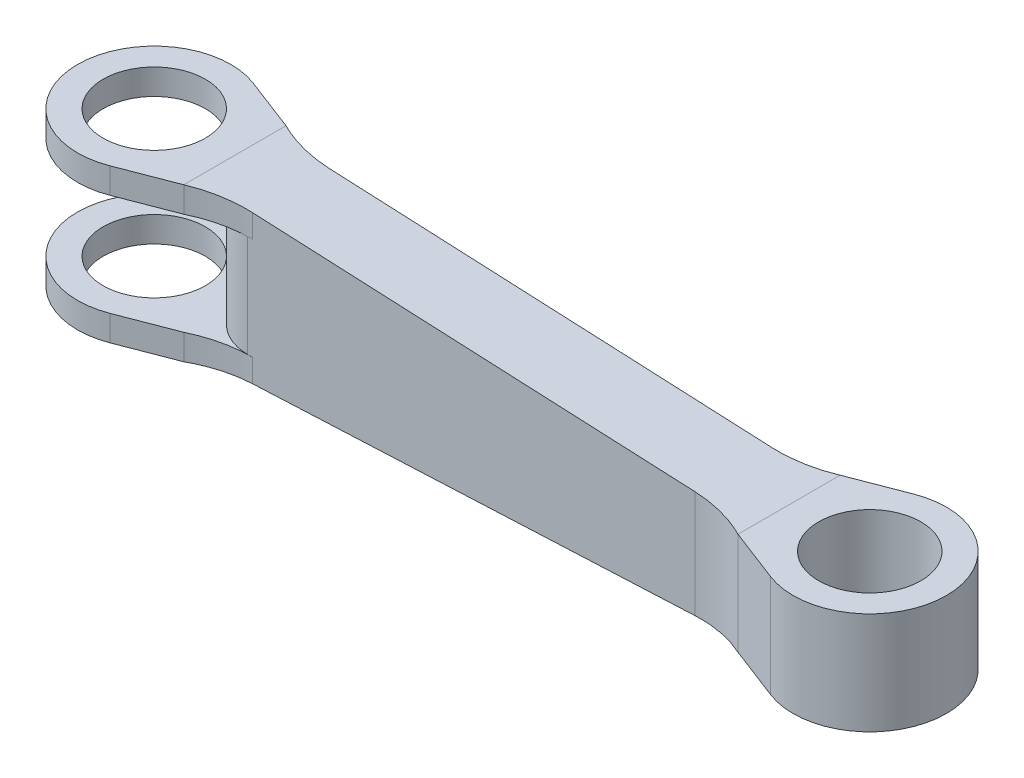
from build123d import *

# Parameters (mm, degrees)
SKETCH1_R           = 5.08
BOSS_EXTRUDE1_DEPTH = 7.62
SKETCH2_W           = 15.638324702
SKETCH2_H           = 10.16
CUT_EXTRUDE1_DEPTH  = 83.001098163
FILLET1_R           = 12.7
FILLET2_R           = 5.08


with BuildPart() as part:
    # Sketch1 → Boss-Extrude1 (new, symmetric)
    with BuildSketch(Plane(origin=(0, 0, 0), x_dir=(1, 0, 0), z_dir=(0, 1, 0))):
        with BuildLine():
            Line((2.735663722, 7.112), (8.018324702, 5.08))
            Line((8.018324702, 5.08), (8.018324702, 3.81))
            Line((8.018324702, 3.81), (63.101675298, 3.81))
            Line((63.101675298, 3.81), (63.101675298, 5.08))
            Line((63.101675298, 5.08), (68.384336278, 7.112))
            ThreePointArc((68.384336278, 7.112), (78.74, 0), (68.384336278, -7.112))
            Line((68.384336278, -7.112), (63.101675298, -5.08))
            Line((63.101675298, -5.08), (63.101675298, -3.81))
            Line((63.101675298, -3.81), (8.018324702, -3.81))
            Line((8.018324702, -3.81), (8.018324702, -5.08))
            Line((8.018324702, -5.08), (2.735663722, -7.112))
            ThreePointArc((2.735663722, -7.112), (-7.62, 0), (2.735663722, 7.112))
        make_face()
        with Locations(Location((0, 0, 0), (0, 0, 90))):
            Circle(SKETCH1_R, mode=Mode.SUBTRACT)
        with Locations(Location((71.12, 0, 0), (0, 0, 90))):
            Circle(SKETCH1_R, mode=Mode.SUBTRACT)
    extrude(amount=BOSS_EXTRUDE1_DEPTH, both=True)

    # Sketch2 → Cut-Extrude1 (cut, through all)
    with BuildSketch(Plane.XY.offset(13.97)):
        Polygon((8.018324702, 7.62), (63.101675298, 5.08), (78.74, 5.08), (78.74, 7.62), align=None)
        with Locations((0.199162351, 0)):
            Rectangle(SKETCH2_W, SKETCH2_H)
        Polygon((63.101675298, -5.08), (78.74, -5.08), (78.74, -7.62), (8.018324702, -7.62), align=None)
    extrude(amount=-CUT_EXTRUDE1_DEPTH, mode=Mode.SUBTRACT)

    # Fillet1
    # the kernel refuses this fillet: 12.7 mm, written as the material it adds along each edge
    with BuildSketch(Plane(origin=(63.101675298, 18.919504146, 3.81), x_dir=(-1, 0, 0), z_dir=(0, -1, 0))) as fillet1_piece_1_section:
        with BuildLine():
            CenterArc((5.535801658, -12.7), FILLET1_R, 90, 25.841932763)
            Line((0, -1.27), (0, 0))
            Line((0, 0), (5.535801658, 0))
        make_face()
    fillet1_piece_1 = extrude(amount=37.839008291, mode=Mode.PRIVATE)
    fillet1_piece_1 = split(fillet1_piece_1, bisect_by=Plane(origin=(59.36502655, 5.252304112, 3.912132652), z_dir=(-0.04606299102663346, -0.9989385370770718, 0)), keep=Keep.TOP, mode=Mode.PRIVATE)
    fillet1_piece_1 = split(fillet1_piece_1, bisect_by=Plane(origin=(59.844275634, -5.230205009, 3.912132652), z_dir=(-0.04606299102663346, 0.9989385370770718, 0)), keep=Keep.TOP, mode=Mode.PRIVATE)
    add(fillet1_piece_1)
    with BuildSketch(Plane(origin=(63.101675298, 18.919504146, -3.81), x_dir=(0, 0, -1), z_dir=(0, -1, 0))) as fillet1_piece_2_section:
        with BuildLine():
            CenterArc((12.7, -5.535801658), FILLET1_R, 154.158067237, 25.841932763)
            Line((0, -5.535801658), (0, 0))
            Line((0, 0), (1.27, 0))
        make_face()
    fillet1_piece_2 = extrude(amount=37.839008291, mode=Mode.PRIVATE)
    fillet1_piece_2 = split(fillet1_piece_2, bisect_by=Plane(origin=(62.135782482, 5.124539189, -4.63296), z_dir=(-0.04606299102663346, -0.9989385370770718, 0)), keep=Keep.TOP, mode=Mode.PRIVATE)
    fillet1_piece_2 = split(fillet1_piece_2, bisect_by=Plane(origin=(62.604689444, -5.10291698, -4.63296), z_dir=(-0.04606299102663346, 0.9989385370770718, 0)), keep=Keep.TOP, mode=Mode.PRIVATE)
    add(fillet1_piece_2)
    with BuildSketch(Plane(origin=(8.018324702, 8.759504146, -3.81), x_dir=(1, 0, 0), z_dir=(0, -1, 0))) as fillet1_piece_3_section:
        with BuildLine():
            CenterArc((5.535801658, -12.7), FILLET1_R, 90, 25.841932763)
            Line((0, -1.27), (0, 0))
            Line((0, 0), (5.535801658, 0))
        make_face()
    fillet1_piece_3 = extrude(amount=30.219008291, mode=Mode.PRIVATE)
    fillet1_piece_3 = split(fillet1_piece_3, bisect_by=Plane(origin=(11.809644031, 7.445174921, -3.912132652), z_dir=(-0.04606299102663346, -0.9989385370770718, 0)), keep=Keep.TOP, mode=Mode.PRIVATE)
    fillet1_piece_3 = split(fillet1_piece_3, bisect_by=Plane(origin=(11.757033309, 5.08, -3.912132652), z_dir=(0, 1, 0)), keep=Keep.TOP, mode=Mode.PRIVATE)
    add(fillet1_piece_3)
    with BuildSketch(Plane(origin=(8.018324702, -5.08, -3.81), x_dir=(1, 0, 0), z_dir=(0, -1, 0))) as fillet1_piece_4_section:
        with BuildLine():
            CenterArc((5.535801658, -12.7), FILLET1_R, 90, 25.841932763)
            Line((0, -1.27), (0, 0))
            Line((0, 0), (5.535801658, 0))
        make_face()
    fillet1_piece_4 = extrude(amount=16.379504146, mode=Mode.PRIVATE)
    fillet1_piece_4 = split(fillet1_piece_4, bisect_by=Plane(origin=(11.809644031, -7.445174921, -3.912132652), z_dir=(-0.04606299102663346, 0.9989385370770718, 0)), keep=Keep.TOP, mode=Mode.PRIVATE)
    add(fillet1_piece_4)
    with BuildSketch(Plane(origin=(8.018324702, 21.459504146, -3.81), x_dir=(1, 0, 0), z_dir=(0, -1, 0))) as fillet1_piece_5_section:
        with BuildLine():
            CenterArc((5.535801658, -12.7), FILLET1_R, 90, 25.841932763)
            Line((0, -1.27), (0, 0))
            Line((0, 0), (5.535801658, 0))
        make_face()
    fillet1_piece_5 = extrude(amount=16.379504146, mode=Mode.PRIVATE)
    fillet1_piece_5 = split(fillet1_piece_5, bisect_by=Plane(origin=(11.809644031, 7.445174921, -3.912132652), z_dir=(-0.04606299102663346, -0.9989385370770718, 0)), keep=Keep.TOP, mode=Mode.PRIVATE)
    add(fillet1_piece_5)
    with BuildSketch(Plane(origin=(8.018324702, 21.459504146, -3.81), x_dir=(1, 0, 0), z_dir=(0, -1, 0))) as fillet1_piece_6_section:
        with BuildLine():
            CenterArc((5.535801658, -12.7), FILLET1_R, 90, 25.841932763)
            Line((0, -1.27), (0, 0))
            Line((0, 0), (5.535801658, 0))
        make_face()
    fillet1_piece_6 = extrude(amount=30.219008291, mode=Mode.PRIVATE)
    fillet1_piece_6 = split(fillet1_piece_6, bisect_by=Plane(origin=(11.757033309, -5.08, -3.912132652), z_dir=(0, -1, 0)), keep=Keep.TOP, mode=Mode.PRIVATE)
    fillet1_piece_6 = split(fillet1_piece_6, bisect_by=Plane(origin=(11.809644031, -7.445174921, -3.912132652), z_dir=(-0.04606299102663346, 0.9989385370770718, 0)), keep=Keep.TOP, mode=Mode.PRIVATE)
    add(fillet1_piece_6)
    with BuildSketch(Plane(origin=(8.018324702, 8.759504146, 3.81), x_dir=(1, 0, 0), z_dir=(0, -1, 0))) as fillet1_piece_7_section:
        with BuildLine():
            CenterArc((5.535801658, 12.7), FILLET1_R, 244.158067237, 25.841932763)
            Line((0, 1.27), (0, 0))
            Line((0, 0), (5.535801658, 0))
        make_face()
    fillet1_piece_7 = extrude(amount=30.219008291, mode=Mode.PRIVATE)
    fillet1_piece_7 = split(fillet1_piece_7, bisect_by=Plane(origin=(11.809644031, 7.445174921, 3.912132652), z_dir=(-0.04606299102663346, -0.9989385370770718, 0)), keep=Keep.TOP, mode=Mode.PRIVATE)
    fillet1_piece_7 = split(fillet1_piece_7, bisect_by=Plane(origin=(11.757033309, 5.08, 3.912132652), z_dir=(0, 1, 0)), keep=Keep.TOP, mode=Mode.PRIVATE)
    add(fillet1_piece_7)
    with BuildSketch(Plane(origin=(8.018324702, -5.08, 3.81), x_dir=(1, 0, 0), z_dir=(0, -1, 0))) as fillet1_piece_8_section:
        with BuildLine():
            CenterArc((5.535801658, 12.7), FILLET1_R, 244.158067237, 25.841932763)
            Line((0, 1.27), (0, 0))
            Line((0, 0), (5.535801658, 0))
        make_face()
    fillet1_piece_8 = extrude(amount=16.379504146, mode=Mode.PRIVATE)
    fillet1_piece_8 = split(fillet1_piece_8, bisect_by=Plane(origin=(11.809644031, -7.445174921, 3.912132652), z_dir=(-0.04606299102663346, 0.9989385370770718, 0)), keep=Keep.TOP, mode=Mode.PRIVATE)
    add(fillet1_piece_8)
    with BuildSketch(Plane(origin=(8.018324702, 21.459504146, 3.81), x_dir=(0, 0, 1), z_dir=(0, -1, 0))) as fillet1_piece_9_section:
        with BuildLine():
            CenterArc((12.7, -5.535801658), FILLET1_R, 154.158067237, 25.841932763)
            Line((0, -5.535801658), (0, 0))
            Line((0, 0), (1.27, 0))
        make_face()
    fillet1_piece_9 = extrude(amount=16.379504146, mode=Mode.PRIVATE)
    fillet1_piece_9 = split(fillet1_piece_9, bisect_by=Plane(origin=(9.041953552, 7.572798491, 4.63296), z_dir=(-0.04606299102663346, -0.9989385370770718, 0)), keep=Keep.TOP, mode=Mode.PRIVATE)
    add(fillet1_piece_9)
    with BuildSketch(Plane(origin=(8.018324702, 21.459504146, 3.81), x_dir=(0, 0, 1), z_dir=(0, -1, 0))) as fillet1_piece_10_section:
        with BuildLine():
            CenterArc((12.7, -5.535801658), FILLET1_R, 154.158067237, 25.841932763)
            Line((0, -5.535801658), (0, 0))
            Line((0, 0), (1.27, 0))
        make_face()
    fillet1_piece_10 = extrude(amount=30.219008291, mode=Mode.PRIVATE)
    fillet1_piece_10 = split(fillet1_piece_10, bisect_by=Plane(origin=(8.985567945, -5.08, 4.63296), z_dir=(0, -1, 0)), keep=Keep.TOP, mode=Mode.PRIVATE)
    fillet1_piece_10 = split(fillet1_piece_10, bisect_by=Plane(origin=(9.041953552, -7.572798491, 4.63296), z_dir=(-0.04606299102663346, 0.9989385370770718, 0)), keep=Keep.TOP, mode=Mode.PRIVATE)
    add(fillet1_piece_10)

    # Fillet2
    # the kernel refuses this fillet: 5.08 mm, written as the material it takes off along each edge
    with BuildSketch(Plane(origin=(8.018324702, 5.08, -3.81), x_dir=(1, 0, 0), z_dir=(0, -1, 0)), Plane(origin=(8.018324702, 5.08, 3.81), x_dir=(0, 0, -1), z_dir=(0, -1, 0))) as fillet2_piece_1:
        with BuildLine():
            CenterArc((FILLET2_R, FILLET2_R), FILLET2_R, 180, 90)
            Line((0, FILLET2_R), (0, 0))
            Line((0, 0), (FILLET2_R, 0))
        make_face()
    extrude(amount=10.16, mode=Mode.SUBTRACT)


solid = part.part
